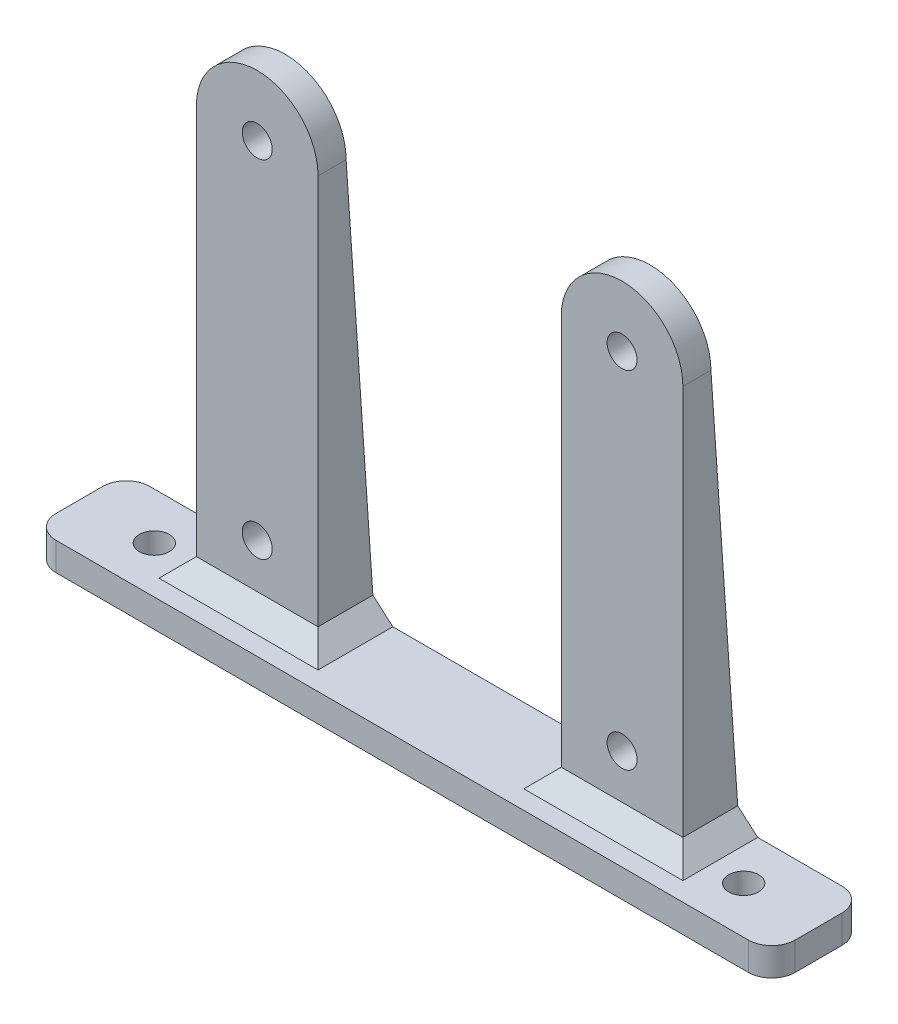
from build123d import *

# Parameters (mm, degrees)
SKETCH_1_W                 = 79
SKETCH_1_H                 = 10
EXTRUDE_1_DEPTH            = 3
SKETCH_2_W                 = 13
SKETCH_2_H                 = 3
EXTRUDE_2_DEPTH            = 43.75
EXTRUDE_3_DEPTH            = 3
RIB_1_REACH                = 87.005
SKETCH_5_WALL_W            = 215.862295072
SKETCH_5_WALL_H            = 2
RIB_2_REACH                = 77.444
SKETCH_7_WALL_W            = 196.740940164
SKETCH_7_WALL_H            = 2
SKETCH_8_R                 = 1.6
CUT_EXTRUDE_1_DEPTH        = 3
FILLET_1_R                 = 2.5
SKETCH_9_R                 = 1.6
CUT_EXTRUDE_5_DEPTH        = 3
CHAMFER_2_SIZE             = 2
CHAMFER_2_OF_MIRROR_1_SIZE = 2


with BuildPart() as part:
    # 草图1 → 凸台-拉伸1 (new body)
    with BuildSketch(Plane(origin=(0, 0, 0), x_dir=(1, 0, 0), z_dir=(0, 1, 0))):
        with Locations((39.5, 5)):
            Rectangle(SKETCH_1_W, SKETCH_1_H)
    extrude(amount=EXTRUDE_1_DEPTH)

    # 草图2 → 凸台-拉伸2 (add)
    with BuildSketch(Plane(origin=(0, 3, 0), x_dir=(1, 0, 0), z_dir=(0, 1, 0))):
        with Locations((20, 5.5)):
            Rectangle(SKETCH_2_W, SKETCH_2_H)
    extrude_2 = extrude(amount=EXTRUDE_2_DEPTH)

    # 草图4 → 凸台-拉伸3 (add)
    with BuildSketch(Plane.XY.offset(-4)):
        with BuildLine():
            Line((13.5, 46.75), (26.5, 46.75))
            ThreePointArc((26.5, 46.75), (20, 53.25), (13.5, 46.75))
        make_face()
    extrude_3 = extrude(amount=-EXTRUDE_3_DEPTH)

    # 草图5 wall → 筋1 (add, up to next)
    with BuildSketch(Plane(origin=(13.5, 24.875, -8.5), x_dir=(0, 0.997657238183, 0.068410782047), z_dir=(0, 0.068410782047, -0.997657238183)), mode=Mode.PRIVATE) as rib_1_sk1:
        with Locations((0, 1)):
            Rectangle(SKETCH_5_WALL_W, SKETCH_5_WALL_H)
    rib_1_tool1 = extrude(rib_1_sk1.sketch, amount=-RIB_1_REACH, mode=Mode.PRIVATE) - part.part
    rib_1 = rib_1_tool1.solids().sort_by_distance((13.5, 24.875, -8.5))[0]
    add(rib_1)

    # 草图7 wall → 筋2 (add, up to next)
    with BuildSketch(Plane(origin=(26.5, 24.875, -8.5), x_dir=(0, -0.997657238183, -0.068410782047), z_dir=(0, 0.068410782047, -0.997657238183)), mode=Mode.PRIVATE) as rib_2_sk1:
        with Locations((0, 1)):
            Rectangle(SKETCH_7_WALL_W, SKETCH_7_WALL_H)
    rib_2_tool1 = extrude(rib_2_sk1.sketch, amount=-RIB_2_REACH, mode=Mode.PRIVATE) - part.part
    rib_2 = rib_2_tool1.solids().sort_by_distance((26.5, 24.875, -8.5))[0]
    add(rib_2)

    # 草图8 → 切除-拉伸1 (cut)
    with BuildSketch(Plane.XY.offset(-4)):
        with Locations((20, 9.75)):
            Circle(SKETCH_8_R)
        with Locations((20, 46.75)):
            Circle(SKETCH_8_R)
    cut_extrude_1 = extrude(amount=-CUT_EXTRUDE_1_DEPTH, mode=Mode.SUBTRACT)

    # 圆角1
    fillet_1_edges = [part.edges().sort_by_distance(p)[0] for p in [
        (0, 1.5, -10),
        (79, 1.5, -10),
        (79, 1.5, 0),
        (0, 1.5, 0),
    ]]
    fillet(fillet_1_edges, radius=FILLET_1_R)

    # 草图9 → 切除-拉伸5 (cut)
    with BuildSketch(Plane(origin=(0, 3, 0), x_dir=(1, 0, 0), z_dir=(0, 1, 0))):
        with Locations((8, 5)):
            Circle(SKETCH_9_R)
        with Locations((71, 5)):
            Circle(SKETCH_9_R)
    extrude(amount=-CUT_EXTRUDE_5_DEPTH, mode=Mode.SUBTRACT)

    # 倒角2
    chamfer_2_edges = [part.edges().sort_by_distance(p)[0] for p in [
        (20, 3, -4),
        (26.5, 3, -7),
        (13.5, 3, -7),
    ]]
    chamfer(chamfer_2_edges, length=CHAMFER_2_SIZE)

    # 镜向1: 凸台-拉伸2, 凸台-拉伸3, 筋1, 筋2, 切除-拉伸1 across plane
    add(extrude_2.mirror(Plane.ZY.offset(-39.5)))
    add(extrude_3.mirror(Plane.ZY.offset(-39.5)))
    add(rib_1.mirror(Plane.ZY.offset(-39.5)))
    add(rib_2.mirror(Plane.ZY.offset(-39.5)))
    add(cut_extrude_1.mirror(Plane.ZY.offset(-39.5)), mode=Mode.SUBTRACT)

    # 倒角2 of 镜向1
    chamfer_2_of_mirror_1_edges = [part.edges().sort_by_distance(p)[0] for p in [
        (59, 3, -4),
        (52.5, 3, -7),
        (65.5, 3, -7),
    ]]
    chamfer(chamfer_2_of_mirror_1_edges, length=CHAMFER_2_OF_MIRROR_1_SIZE)


solid = part.part
